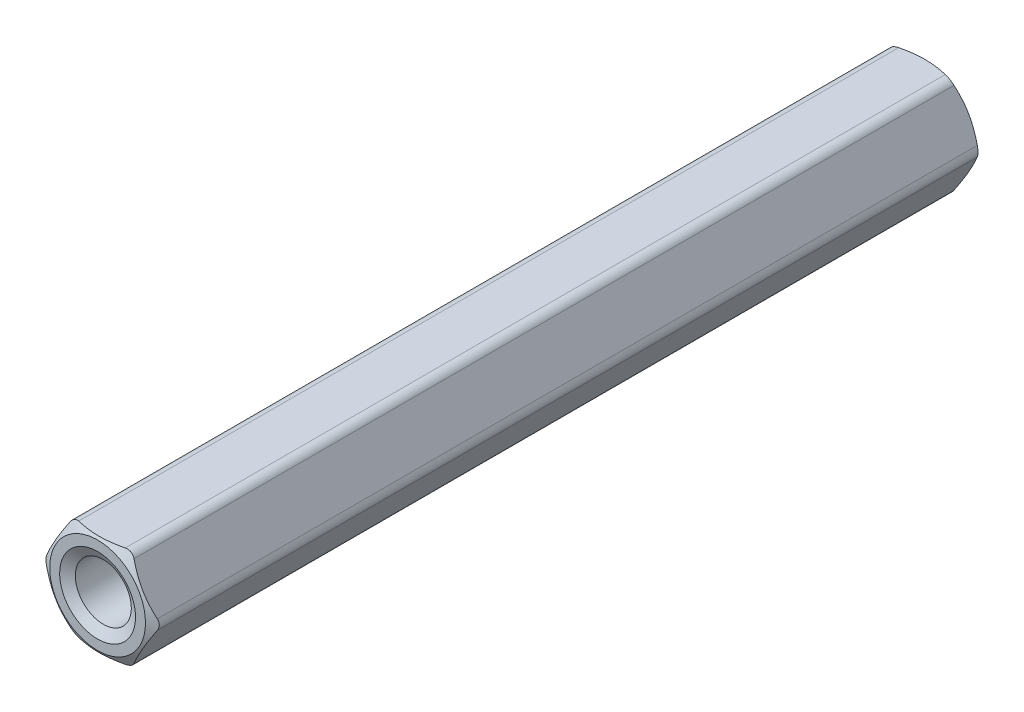
from build123d import *

# Parameters (mm, degrees)
SKETCH4_R           = 1.75
BOSS_EXTRUDE1_DEPTH = 18.5
SKETCH5_OUTSIDE_W   = 146.91
SKETCH5_OUTSIDE_H   = 146.214
SKETCH5_OUTSIDE_R   = 2.1375
CUT_EXTRUDE1_DEPTH  = 38.159285515
CUT_EXTRUDE1_DRAFT  = -60
SKETCH6_OUTSIDE_W   = 146.91
SKETCH6_OUTSIDE_H   = 146.214
SKETCH6_OUTSIDE_R   = 2.1375
CUT_EXTRUDE2_DEPTH  = 38.159285515
CUT_EXTRUDE2_DRAFT  = -60
FILLET1_R           = 0.45


with BuildPart() as part:
    # Sketch3 → Revolve1 (revolve)
    with BuildSketch(Plane(origin=(0, 0, 0), x_dir=(0, 0, -1), z_dir=(1, 0, 0))):
        Polygon((-18.243800818, 1.25), (-13.7, 1.25), (-13.7, 0), (13.7, 0), (13.7, 1.25), (18.243800818, 1.25), (18.5, 1.69375), (18.5, 2.25), (0, 2.25), (-18.5, 2.25), (-18.5, 1.69375), align=None)
        Polygon((-18.243800818, 1.25), (-13.7, 1.25), (-13.7, 0), (13.7, 0), (13.7, 1.25), (18.243800818, 1.25), (18.5, 1.69375), (18.5, 2.25), (0, 2.25), (-18.5, 2.25), (-18.5, 1.69375), align=None)
    revolve(axis=Axis((0, 0, 13.7), (0, 0, 1)))

    # Sketch4 → Boss-Extrude1 (add, symmetric)
    with BuildSketch(Plane.XY):
        Polygon((-1.299038106, 2.25), (-2.598076211, 0), (-1.299038106, -2.25), (1.299038106, -2.25), (2.598076211, 0), (1.299038106, 2.25), align=None)
        Circle(SKETCH4_R, mode=Mode.SUBTRACT)
    extrude(amount=BOSS_EXTRUDE1_DEPTH, both=True)


with BuildPart() as cut_extrude1_tool:
    # Sketch5 outside → Cut-Extrude1 (with draft: the straight prism first)
    with BuildSketch(Plane.XY.offset(18.5)):
        Rectangle(SKETCH5_OUTSIDE_W, SKETCH5_OUTSIDE_H)
        Circle(SKETCH5_OUTSIDE_R, mode=Mode.SUBTRACT)
    extrude(amount=-CUT_EXTRUDE1_DEPTH)
    # Cut-Extrude1: the draft: its side faces are tilted about the plane it starts from
    cut_extrude1_sides = [cut_extrude1_tool.faces().sort_by_distance(p)[0] for p in [
        (0, -73.107, -0.579642758),
        (73.455, 0, -0.579642758),
        (0, 73.107, -0.579642758),
        (-73.455, 0, -0.579642758),
        (-2.1375, 0, -0.579642758),
    ]]
    draft(cut_extrude1_sides, Plane.XY.offset(18.5), CUT_EXTRUDE1_DRAFT)


with BuildPart() as part_1:
    add(part.part)

    # Cut-Extrude1: cut by cut_extrude1_tool
    add(cut_extrude1_tool.part, mode=Mode.SUBTRACT)


with BuildPart() as cut_extrude2_tool:
    # Sketch6 outside → Cut-Extrude2 (with draft: the straight prism first)
    with BuildSketch(Plane(origin=(0, 0, -18.5), x_dir=(-1, 0, 0), z_dir=(0, 0, -1))):
        Rectangle(SKETCH6_OUTSIDE_W, SKETCH6_OUTSIDE_H)
        Circle(SKETCH6_OUTSIDE_R, mode=Mode.SUBTRACT)
    extrude(amount=-CUT_EXTRUDE2_DEPTH)
    # Cut-Extrude2: the draft: its side faces are tilted about the plane it starts from
    cut_extrude2_sides = [cut_extrude2_tool.faces().sort_by_distance(p)[0] for p in [
        (0, -73.107, 0.579642758),
        (-73.455, 0, 0.579642758),
        (0, 73.107, 0.579642758),
        (73.455, 0, 0.579642758),
        (2.1375, 0, 0.579642758),
    ]]
    draft(cut_extrude2_sides, Plane(origin=(0, 0, -18.5), x_dir=(-1, 0, 0), z_dir=(0, 0, -1)), CUT_EXTRUDE2_DRAFT)


with BuildPart() as part_2:
    add(part_1.part)

    # Cut-Extrude2: cut by cut_extrude2_tool
    add(cut_extrude2_tool.part, mode=Mode.SUBTRACT)

    # Fillet1
    # the kernel refuses this fillet: 0.45 mm, written as the material it takes off along each edge
    with BuildSketch(Plane(origin=(1.299038106, 2.25, 18.883605253), x_dir=(-1, 0, 0), z_dir=(0, 0, -1)), Plane(origin=(-1.299038106, 2.25, 18.883605253), x_dir=(-0.49999999999999967, -0.8660254037844387, 0), z_dir=(0, 0, -1))) as fillet1_piece_1:
        with BuildLine():
            CenterArc((FILLET1_R * 0.57735026919, -FILLET1_R), FILLET1_R, 90, 60)
            Line((-FILLET1_R * 0.288675134595, -FILLET1_R * 0.5), (0, 0))
            Line((0, 0), (FILLET1_R * 0.57735026919, 0))
        make_face()
    extrude(amount=37.767210506, mode=Mode.SUBTRACT)
    with BuildSketch(Plane(origin=(-2.598076211, 0, -18.883605253), x_dir=(0.5000000000000006, -0.8660254037844384, 0), z_dir=(0, 0, 1)), Plane(origin=(-1.299038106, -2.25, -18.883605253), x_dir=(1, 0, 0), z_dir=(0, 0, 1)), Plane(origin=(1.299038106, -2.25, -18.883605253), x_dir=(0.49999999999999967, 0.8660254037844387, 0), z_dir=(0, 0, 1)), Plane(origin=(2.598076211, 0, 18.883605253), x_dir=(-0.5, -0.8660254037844388, 0), z_dir=(0, 0, -1))) as fillet1_piece_2:
        with BuildLine():
            CenterArc((FILLET1_R * 0.57735026919, FILLET1_R), FILLET1_R, 210, 60)
            Line((-FILLET1_R * 0.288675134595, FILLET1_R * 0.5), (0, 0))
            Line((0, 0), (FILLET1_R * 0.57735026919, 0))
        make_face()
    extrude(amount=37.767210506, mode=Mode.SUBTRACT)


solid = part_2.part
